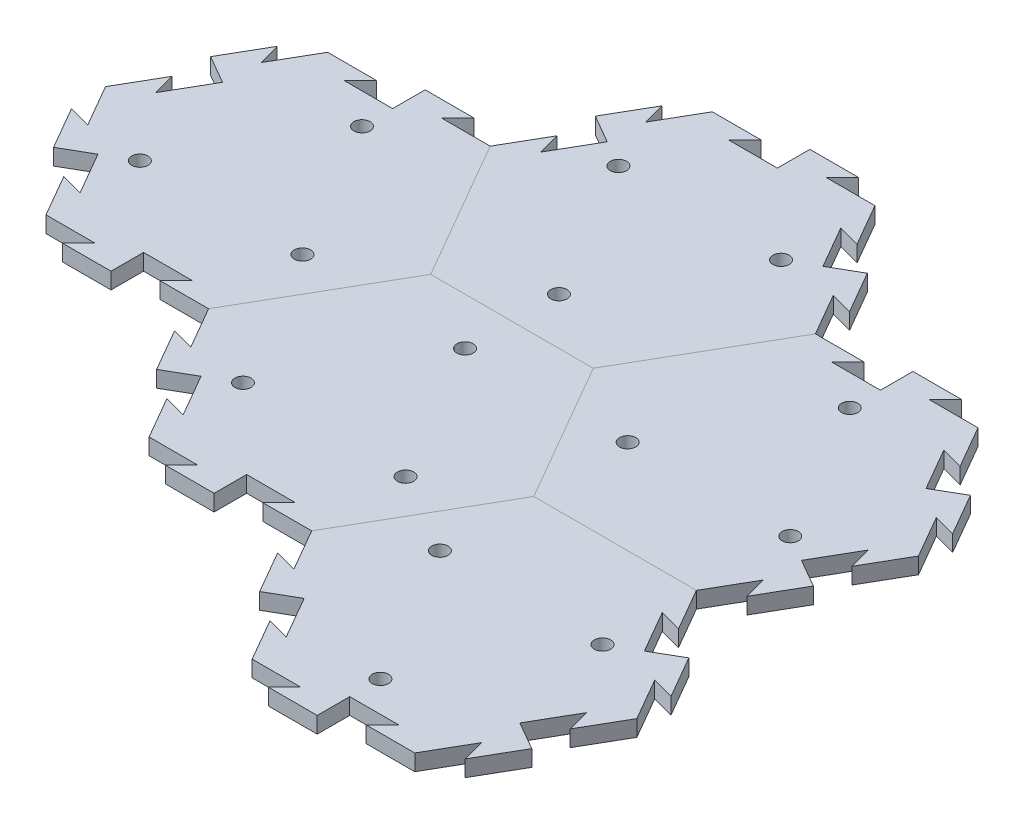
from build123d import *

# Parameters (mm, degrees)
BOSS_EXTRUDE1_DEPTH     = 6.35
SKETCH9_R               = 3.175
CUT_EXTRUDE3_DEPTH      = 85.242269675
CIRPATTERN6_COUNT       = 3
CUT_EXTRUDE2_DEPTH      = 194.232075495
BOSS_EXTRUDE3_DEPTH     = 6.35
CIRPATTERN3_COUNT       = 3
CIRPATTERN3_ANGLE       = 120
CIRPATTERN5_START       = -6.35
CIRPATTERN5_OUTLINE_R   = 3.175
CIRPATTERN5_DEPTH       = 6.35
CIRPATTERN5_2_OUTLINE_R = 3.175
CIRPATTERN5_2_DEPTH     = 6.35
CIRPATTERN5_3_OUTLINE_R = 3.175
CIRPATTERN5_3_DEPTH     = 6.35
BOSS_EXTRUDE4_DEPTH     = 6.35
CUT_EXTRUDE4_DEPTH      = 234.655972662
CIRPATTERN7_COUNT       = 2
CIRPATTERN7_ANGLE       = 60
CUT_EXTRUDE5_DEPTH      = 234.655972662
BOSS_EXTRUDE5_DEPTH     = 6.35
CUT_EXTRUDE6_DEPTH      = 234.655972662
BOSS_EXTRUDE6_DEPTH     = 6.35


# Read off the part's stored shape, not the designer's step: CirPattern5
with BuildPart() as part:
    # Sketch1 → Boss-Extrude1 (new body)
    with BuildSketch(Plane(origin=(0, 0, 0), x_dir=(1, 0, 0), z_dir=(0, 1, 0))):
        Polygon((63.5, 0), (31.75, 54.99261314), (-31.75, 54.99261314), (-63.5, 0), (-31.75, -54.99261314), (31.75, -54.99261314), align=None)
    extrude(amount=-BOSS_EXTRUDE1_DEPTH)

    # Sketch9 → Cut-Extrude3 (cut, through all)
    with BuildSketch(Plane(origin=(0, 0, 0), x_dir=(1, 0, 0), z_dir=(0, 1, 0))):
        with Locations(Location((-31.75, -18.330871047, 0), (0, 0, 270))):
            Circle(SKETCH9_R)
    cut_extrude3 = extrude(amount=-CUT_EXTRUDE3_DEPTH, mode=Mode.SUBTRACT)

    # CirPattern6: Cut-Extrude3 ×3 about axis
    cirpattern6_axis = Axis((0, 0, 0), (0, 1, 0))
    for i in range(1, CIRPATTERN6_COUNT):
        add(cut_extrude3.rotate(cirpattern6_axis, i * 360 / CIRPATTERN6_COUNT), mode=Mode.SUBTRACT)


with BuildPart() as body_2:
    # Mirror1: mirrored copy
    add(part.part.mirror(Plane(origin=(31.75, -6.35, 54.99261314), x_dir=(-0.4999999999999997, 0, 0.8660254037844387), z_dir=(0.8660254037844387, 0, 0.49999999999999983))))

    # Sketch5 → Cut-Extrude2 (cut, through all)
    with BuildSketch(Plane(origin=(0, 0, 0), x_dir=(1, 0, 0), z_dir=(0, 1, 0))):
        Polygon((136.525, -16.497783942), (127.850738686, -14.173522628), (137.375738686, -30.67130657), (142.875, -27.49630657), align=None)
    cut_extrude2 = extrude(amount=-CUT_EXTRUDE2_DEPTH, mode=Mode.SUBTRACT)

    # Sketch7 → Boss-Extrude3 (add)
    with BuildSketch(Plane(origin=(0, 0, 0), x_dir=(1, 0, 0), z_dir=(0, 1, 0))):
        Polygon((142.875, -27.49630657), (148.374261314, -24.32130657), (157.899261314, -40.819090512), (149.225, -38.494829198), align=None)
    boss_extrude3 = extrude(amount=-BOSS_EXTRUDE3_DEPTH)

    # CirPattern3: Cut-Extrude2, Boss-Extrude3 ×3 about axis
    cirpattern3_axis = Axis((95.25, 0, 54.99261314), (0, -1, 0))
    add([cut_extrude2.rotate(cirpattern3_axis, i * CIRPATTERN3_ANGLE / (CIRPATTERN3_COUNT - 1)) for i in range(1, CIRPATTERN3_COUNT)], mode=Mode.SUBTRACT)
    add([boss_extrude3.rotate(cirpattern3_axis, i * CIRPATTERN3_ANGLE / (CIRPATTERN3_COUNT - 1)) for i in range(1, CIRPATTERN3_COUNT)])

    # Sketch14 → Cut-Extrude6 (cut, through all)
    with BuildSketch(Plane(origin=(0, 0, 0), x_dir=(1, 0, 0), z_dir=(0, 1, 0))):
        Polygon((47.625, -82.48891971), (53.124261314, -79.31391971), (62.649261314, -95.811703653), (53.975, -93.487442339), align=None)
    extrude(amount=-CUT_EXTRUDE6_DEPTH, mode=Mode.SUBTRACT)

    # Sketch15 → Boss-Extrude6 (add)
    with BuildSketch(Plane(origin=(0, 0, 0), x_dir=(1, 0, 0), z_dir=(0, 1, 0))):
        Polygon((47.625, -82.48891971), (42.125738686, -85.66391971), (32.600738686, -69.166135768), (41.275, -71.490397082), align=None)
    extrude(amount=-BOSS_EXTRUDE6_DEPTH)


with BuildPart() as body_3:
    # CirPattern5 outline → CirPattern5 (new body)
    with BuildSketch(Plane(origin=(0, 0, 0), x_dir=(1, 0, 0), z_dir=(0, 1, 0)).offset(CIRPATTERN5_START)):
        Polygon((-31.75, 54.99261314), (-63.5, 109.985226281), (-82.55, 109.985226281), (-76.2, 116.335226281), (-95.25, 116.335226281), (-95.25, 103.635226281), (-114.3, 103.635226281), (-107.95, 109.985226281), (-127, 109.985226281), (-136.525, 93.487442339), (-138.849261314, 102.161703653), (-148.374261314, 85.66391971), (-137.375738686, 79.31391971), (-146.900738686, 62.816135768), (-149.225, 71.490397082), (-158.75, 54.99261314), (-149.225, 38.494829198), (-157.899261314, 40.819090512), (-148.374261314, 24.32130657), (-137.375738686, 30.67130657), (-127.850738686, 14.173522628), (-136.525, 16.497783942), (-127, 0), (-63.5, 0), align=None)
        with Locations((-127, 36.661742094)):
            Circle(CIRPATTERN5_OUTLINE_R, mode=Mode.SUBTRACT)
        with Locations((-63.5, 36.661742094)):
            Circle(CIRPATTERN5_OUTLINE_R, mode=Mode.SUBTRACT)
        with Locations((-95.25, 91.654355234)):
            Circle(CIRPATTERN5_OUTLINE_R, mode=Mode.SUBTRACT)
    extrude(amount=CIRPATTERN5_DEPTH)

    # Sketch12 → Cut-Extrude5 (cut, through all)
    with BuildSketch(Plane(origin=(0, 0, 0), x_dir=(1, 0, 0), z_dir=(0, 1, 0))):
        Polygon((-95.25, 0), (-95.25, 6.35), (-76.2, 6.35), (-82.55, 0), align=None)
    extrude(amount=-CUT_EXTRUDE5_DEPTH, mode=Mode.SUBTRACT)

    # Sketch13 → Boss-Extrude5 (add)
    with BuildSketch(Plane(origin=(0, 0, 0), x_dir=(1, 0, 0), z_dir=(0, 1, 0))):
        Polygon((-95.25, 0), (-95.25, -6.35), (-114.3, -6.35), (-107.95, 0), align=None)
    extrude(amount=-BOSS_EXTRUDE5_DEPTH)


with BuildPart() as body_4:
    # CirPattern5 2 outline → CirPattern5 2 (new body)
    with BuildSketch(Plane(origin=(0, 0, 0), x_dir=(1, 0, 0), z_dir=(0, 1, 0)).offset(CIRPATTERN5_START)):
        Polygon((31.75, 54.99261314), (63.5, 109.985226281), (53.975, 126.483010223), (62.649261314, 124.158748909), (53.124261314, 140.656532851), (42.125738686, 134.306532851), (32.600738686, 150.804316793), (41.275, 148.480055479), (31.75, 164.977839421), (12.7, 164.977839421), (19.05, 171.327839421), (0, 171.327839421), (0, 158.627839421), (-19.05, 158.627839421), (-12.7, 164.977839421), (-31.75, 164.977839421), (-41.275, 148.480055479), (-43.599261314, 157.154316793), (-53.124261314, 140.656532851), (-42.125738686, 134.306532851), (-51.650738686, 117.808748909), (-53.975, 126.483010223), (-63.5, 109.985226281), (-31.75, 54.99261314), align=None)
        with Locations((0, 73.323484187)):
            Circle(CIRPATTERN5_2_OUTLINE_R, mode=Mode.SUBTRACT)
        with Locations((-31.75, 128.316097327)):
            Circle(CIRPATTERN5_2_OUTLINE_R, mode=Mode.SUBTRACT)
        with Locations((31.75, 128.316097327)):
            Circle(CIRPATTERN5_2_OUTLINE_R, mode=Mode.SUBTRACT)
    extrude(amount=CIRPATTERN5_2_DEPTH)


with BuildPart() as body_5:
    # CirPattern5 3 outline → CirPattern5 3 (new body)
    with BuildSketch(Plane(origin=(0, 0, 0), x_dir=(1, 0, 0), z_dir=(0, 1, 0)).offset(CIRPATTERN5_START)):
        Polygon((63.5, 0), (127, 0), (136.525, 16.497783942), (138.849261314, 7.823522628), (148.374261314, 24.32130657), (137.375738686, 30.67130657), (146.900738686, 47.169090512), (149.225, 38.494829198), (158.75, 54.99261314), (149.225, 71.490397082), (157.899261314, 69.166135768), (148.374261314, 85.66391971), (137.375738686, 79.31391971), (127.850738686, 95.811703653), (136.525, 93.487442339), (127, 109.985226281), (107.95, 109.985226281), (114.3, 116.335226281), (95.25, 116.335226281), (95.25, 103.635226281), (76.2, 103.635226281), (82.55, 109.985226281), (63.5, 109.985226281), (31.75, 54.99261314), align=None)
        with Locations((63.5, 36.661742094)):
            Circle(CIRPATTERN5_3_OUTLINE_R, mode=Mode.SUBTRACT)
        with Locations((127, 36.661742094)):
            Circle(CIRPATTERN5_3_OUTLINE_R, mode=Mode.SUBTRACT)
        with Locations((95.25, 91.654355234)):
            Circle(CIRPATTERN5_3_OUTLINE_R, mode=Mode.SUBTRACT)
    extrude(amount=CIRPATTERN5_3_DEPTH)


with BuildPart() as part_1:
    add(part.part)

    # Sketch10 → Boss-Extrude4 (add)
    with BuildSketch(Plane(origin=(0, 0, 0), x_dir=(1, 0, 0), z_dir=(0, 1, 0))):
        Polygon((-53.975, -16.497783942), (-62.649261314, -14.173522628), (-53.124261314, -30.67130657), (-47.625, -27.49630657), align=None)
    boss_extrude4 = extrude(amount=-BOSS_EXTRUDE4_DEPTH)

    # Sketch11 → Cut-Extrude4 (cut, through all)
    with BuildSketch(Plane(origin=(0, 0, 0), x_dir=(1, 0, 0), z_dir=(0, 1, 0))):
        Polygon((-47.625, -27.49630657), (-42.125738686, -24.32130657), (-32.600738686, -40.819090512), (-41.275, -38.494829198), align=None)
    cut_extrude4 = extrude(amount=-CUT_EXTRUDE4_DEPTH, mode=Mode.SUBTRACT)

    # CirPattern7: Boss-Extrude4, Cut-Extrude4 ×2 about axis
    cirpattern7_axis = Axis((0, 0, 0), (0, 1, 0))
    add([boss_extrude4.rotate(cirpattern7_axis, i * CIRPATTERN7_ANGLE / (CIRPATTERN7_COUNT - 1)) for i in range(1, CIRPATTERN7_COUNT)])
    add([cut_extrude4.rotate(cirpattern7_axis, i * CIRPATTERN7_ANGLE / (CIRPATTERN7_COUNT - 1)) for i in range(1, CIRPATTERN7_COUNT)], mode=Mode.SUBTRACT)


solid = Compound([body_2.part, body_3.part, body_4.part, body_5.part, part_1.part])
